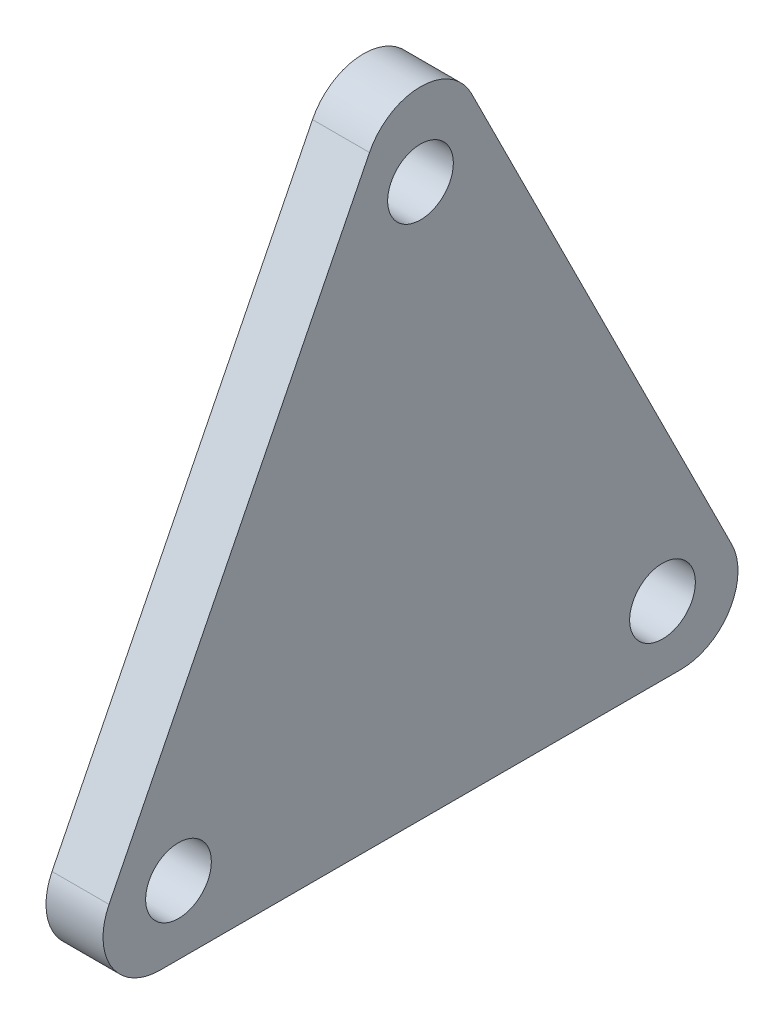
from build123d import *

# Parameters (mm, degrees)
SKETCH1_R           = 1.8288
BOSS_EXTRUDE1_DEPTH = 3.175
FILLET1_R           = 3.175


with BuildPart() as part:
    # Sketch1 → Boss-Extrude1 (new body)
    with BuildSketch(Plane(origin=(0, 0, 0), x_dir=(0, 0, -1), z_dir=(1, 0, 0))):
        Polygon((19.639409497, -3.81), (-19.639409497, -3.81), (0, 35.468818994), align=None)
        with Locations((-13.4747, 0)):
            Circle(SKETCH1_R, mode=Mode.SUBTRACT)
        with Locations((0, 26.9494)):
            Circle(SKETCH1_R, mode=Mode.SUBTRACT)
        with Locations((13.4747, 0)):
            Circle(SKETCH1_R, mode=Mode.SUBTRACT)
    extrude(amount=BOSS_EXTRUDE1_DEPTH)

    # Fillet1
    fillet1_edges = [part.edges().sort_by_distance(p)[0] for p in [
        (1.5875, 35.468818994, 0),
        (1.5875, -3.81, -19.639409497),
        (1.5875, -3.81, 19.639409497),
    ]]
    fillet(fillet1_edges, radius=FILLET1_R)


solid = part.part
